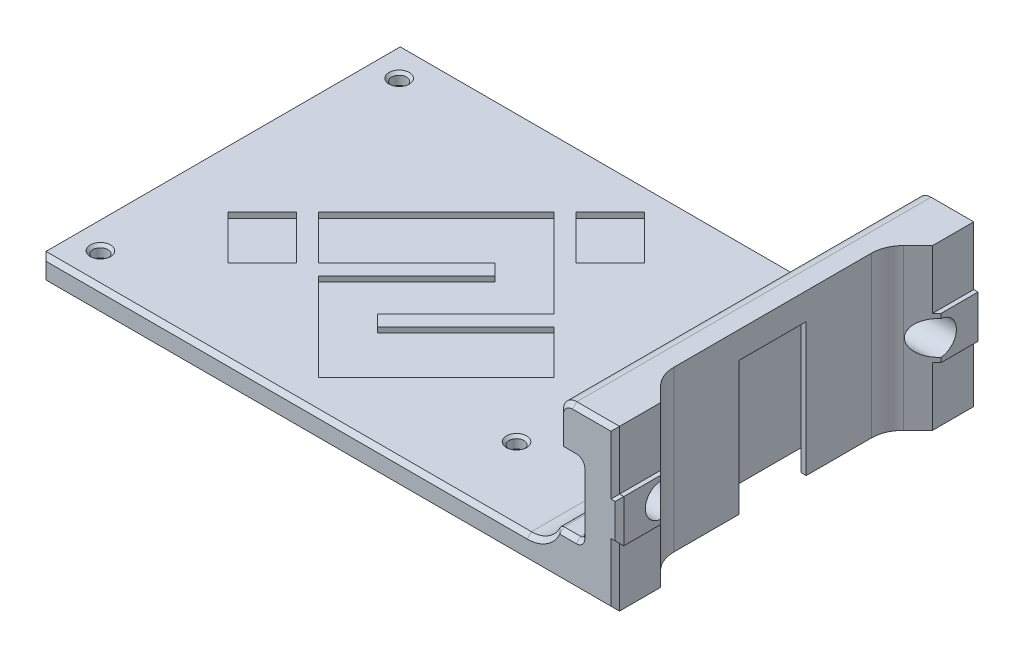
from build123d import *

# Parameters (mm, degrees)
BOSS_MAIN_BODY_DEPTH    = 34
CUT_DOVETAIL_DEPTH      = 25
SKETCH4_R               = 1.4
DRILL_M2_5_HOLES_DEPTH  = 87.327119725
CHAMF_M2_5_SIZE         = 2.5
CHAMF_M2_5_2ND_SIZE     = 0.5
FILLET2_R               = 6
BOSS_EXTRUDE2_DEPTH     = 30
CUT_LOGO_DEPTH          = 1
CUT_LOGO2_START         = -6.431256258
CUT_LOGO2_OUTLINE_W     = 9.1
CUT_LOGO2_OUTLINE_H     = 1
CUT_LOGO2_OUTLINE_W_2   = 31.2
CUT_LOGO2_DEPTH         = 11.7
CUT_LOGO2_START_2       = 19.893743742
CUT_LOGO2_2_OUTLINE_W   = 31.2
CUT_LOGO2_2_OUTLINE_H   = 1
CUT_LOGO2_2_DEPTH       = 11.7
CUT_LOGO2_START_3       = 8.193743742
CUT_LOGO2_3_OUTLINE_W   = 31.2
CUT_LOGO2_3_OUTLINE_H   = 1
CUT_LOGO2_3_DEPTH       = 8.775
CUT_LOGO2_START_4       = 5.268743742
CUT_LOGO2_4_OUTLINE_W   = 7.8
CUT_LOGO2_4_OUTLINE_H   = 1
CUT_LOGO2_4_DEPTH       = 2.925
CUT_LOGO2_START_5       = 16.968743742
CUT_LOGO2_5_OUTLINE_W   = 7.8
CUT_LOGO2_5_OUTLINE_H   = 1
CUT_LOGO2_5_DEPTH       = 2.925
BOSS_DATUM_REACH        = 106.531
SKETCH9_W               = 0.8
SKETCH9_H               = 8
BOSS_EXTRUDE4_START     = -4
BOSS_EXTRUDE4_DEPTH     = 8
FILLET_MAIN_BODY_R      = 2.5
SKETCH8_R               = 3.15
CUT_SCREW_HOLES_DEPTH   = 104.874924789
FILLET3_R               = 6
SKETCH10_W              = 1
SKETCH10_H              = 1
TRIM_DOVETAIL_DEPTH     = 25
HOLE_POCKETS_DEPTH      = 3
HOLE_POCKETS_DEPTH_BACK = 4
FILLET_PEAK_R           = 1.2
FILLET_HOLE_POCKETS_R   = 0.8
CHAMF_FACES_SIZE        = 0.8
CUT_VERSION_NO_DEPTH    = 0.5


# Read off the part's stored shape, not the designer's step: cut_LOGO2, Boss-Extrude4
with BuildPart() as part:
    # Sketch1 → boss_main_body (new, symmetric)
    with BuildSketch(Plane.XY):
        Polygon((-29.54, -10.35), (67.46, -10.35), (67.46, 15), (73.46, 15), (73.46, -15), (-29.54, -15), align=None)
    extrude(amount=BOSS_MAIN_BODY_DEPTH, both=True)

    # Sketch3 → cut_dovetail (cut)
    with BuildSketch(Plane.XZ.offset(15)):
        Polygon((73.46, 5.3), (68.46, 10.3), (68.46, -10.3), (73.46, -5.3), align=None)
    extrude(amount=-CUT_DOVETAIL_DEPTH, mode=Mode.SUBTRACT)

    # Sketch4 → drill_m2.5_holes (cut, through all)
    with BuildSketch(Plane.XZ.offset(15)):
        with Locations(Location((-24.54, 28, 0), (0, 0, 270))):
            Circle(SKETCH4_R)
        with Locations(Location((45.46, 20, 0), (0, 0, 270))):
            Circle(SKETCH4_R)
        with Locations(Location((45.46, -20, 0), (0, 0, 270))):
            Circle(SKETCH4_R)
        with Locations(Location((-24.54, -28, 0), (0, 0, 270))):
            Circle(SKETCH4_R)
    extrude(amount=-DRILL_M2_5_HOLES_DEPTH, mode=Mode.SUBTRACT)

    # chamf_m2.5
    chamf_m2_5_edges = [part.edges().sort_by_distance(p)[0] for p in [
        (-24.54, -15, 29.4),
        (45.46, -15, 21.4),
        (45.46, -15, -18.6),
        (-24.54, -15, -26.6),
    ]]
    chamfer(chamf_m2_5_edges, length=CHAMF_M2_5_SIZE)

    # chamf_m2.5_2nd
    chamf_m2_5_2nd_edges = [part.edges().sort_by_distance(p)[0] for p in [
        (-24.54, -10.35, 29.4),
        (45.46, -10.35, 21.4),
        (45.46, -10.35, -18.6),
        (-24.54, -10.35, -26.6),
    ]]
    chamfer(chamf_m2_5_2nd_edges, length=CHAMF_M2_5_2ND_SIZE)

    # Fillet2
    fillet2_edges = [part.edges().sort_by_distance(p)[0] for p in [
        (67.46, -10.35, 0),
    ]]
    fillet(fillet2_edges, radius=FILLET2_R)

    # Sketch6 → Boss-Extrude2 (add)
    with BuildSketch(Plane(origin=(0, 15, 0), x_dir=(1, 0, 0), z_dir=(0, 1, 0))):
        Polygon((73.46, 34), (77.96, 34), (77.96, 25.5), (73.46, 21), align=None)
        Polygon((73.46, -21), (77.96, -25.5), (77.96, -34), (73.46, -34), align=None)
    extrude(amount=-BOSS_EXTRUDE2_DEPTH)

    # Sketch7 → cut_LOGO (cut)
    with BuildSketch(Plane.XZ.offset(15)):
        Polygon((28.470164677, -21.01903582), (20.197015337, -29.29218516), (13.762343628, -22.857513451), (22.035492968, -14.584364111), align=None)
        Polygon((14.45177274, -7.000643883), (16.520060075, -4.932356548), (-0.026238605, 11.613942132), (16.520060075, 28.160240811), (38.581791648, 6.098509238), (30.308642308, -2.174640102), (13.762343628, 14.371658578), (11.694056293, 12.303371243), (28.240354973, -4.242927437), (11.694056293, -20.789226116), (-10.36767528, 1.272505457), (-2.09452594, 9.545654797), align=None)
        Polygon((-12.435962615, 3.340792792), (-18.870634323, 9.7754645), (-10.597484983, 18.04861384), (-4.162813275, 11.613942131), align=None)
    extrude(amount=-CUT_LOGO_DEPTH, mode=Mode.SUBTRACT)

    # cut_LOGO2 outline → cut_LOGO2 (cut)
    with BuildSketch(Plane(origin=(0, 0, 0), x_dir=(0.707106781186548, 0, -0.707106781186547), z_dir=(0.707106781186547, 0, 0.707106781186548)).offset(CUT_LOGO2_START)):
        with Locations((-15.705850733, -10.85)):
            Rectangle(CUT_LOGO2_OUTLINE_W, CUT_LOGO2_OUTLINE_H)
        with Locations((7.369149267, -10.85)):
            Rectangle(CUT_LOGO2_OUTLINE_W_2, CUT_LOGO2_OUTLINE_H)
        with Locations((30.444149267, -10.85)):
            Rectangle(CUT_LOGO2_OUTLINE_W, CUT_LOGO2_OUTLINE_H)
    extrude(amount=CUT_LOGO2_DEPTH, mode=Mode.SUBTRACT)

    # cut_LOGO2 2 outline → cut_LOGO2 2 (cut)
    with BuildSketch(Plane(origin=(0, 0, 0), x_dir=(0.707106781186548, 0, -0.707106781186547), z_dir=(0.707106781186547, 0, 0.707106781186548)).offset(CUT_LOGO2_START_2)):
        with Locations((7.369149267, -10.85)):
            Rectangle(CUT_LOGO2_2_OUTLINE_W, CUT_LOGO2_2_OUTLINE_H)
    extrude(amount=CUT_LOGO2_2_DEPTH, mode=Mode.SUBTRACT)

    # cut_LOGO2 3 outline → cut_LOGO2 3 (cut)
    with BuildSketch(Plane(origin=(0, 0, 0), x_dir=(0.707106781186548, 0, -0.707106781186547), z_dir=(0.707106781186547, 0, 0.707106781186548)).offset(CUT_LOGO2_START_3)):
        with Locations((7.369149267, -10.85)):
            Rectangle(CUT_LOGO2_3_OUTLINE_W, CUT_LOGO2_3_OUTLINE_H)
    extrude(amount=CUT_LOGO2_3_DEPTH, mode=Mode.SUBTRACT)

    # cut_LOGO2 4 outline → cut_LOGO2 4 (cut)
    with BuildSketch(Plane(origin=(0, 0, 0), x_dir=(0.707106781186548, 0, -0.707106781186547), z_dir=(0.707106781186547, 0, 0.707106781186548)).offset(CUT_LOGO2_START_4)):
        with Locations((19.069149267, -10.85)):
            Rectangle(CUT_LOGO2_4_OUTLINE_W, CUT_LOGO2_4_OUTLINE_H)
    extrude(amount=CUT_LOGO2_4_DEPTH, mode=Mode.SUBTRACT)

    # cut_LOGO2 5 outline → cut_LOGO2 5 (cut)
    with BuildSketch(Plane(origin=(0, 0, 0), x_dir=(0.707106781186548, 0, -0.707106781186547), z_dir=(0.707106781186547, 0, 0.707106781186548)).offset(CUT_LOGO2_START_5)):
        with Locations((-4.330850733, -10.85)):
            Rectangle(CUT_LOGO2_5_OUTLINE_W, CUT_LOGO2_5_OUTLINE_H)
    extrude(amount=CUT_LOGO2_5_DEPTH, mode=Mode.SUBTRACT)

    # boss_datum: up to this plane
    boss_datum_end = Plane(origin=(77.96, -28.756816492, -25.5), z_dir=(0.7071067811865435, 0, 0.7071067811865517))
    # Sketch9 → boss_datum (add, up to the surface)
    with BuildSketch(Plane(origin=(0, 0, -34), x_dir=(-1, 0, 0), z_dir=(0, 0, -1)), mode=Mode.PRIVATE) as boss_datum_sk1:
        with Locations((-78.36, 0)):
            Rectangle(SKETCH9_W, SKETCH9_H)
    boss_datum_tool1 = split(extrude(boss_datum_sk1.sketch, amount=-BOSS_DATUM_REACH, mode=Mode.PRIVATE), bisect_by=boss_datum_end, keep=Keep.BOTH, mode=Mode.PRIVATE)
    add(boss_datum_tool1.solids().sort_by_distance((78.36, 0, -34))[0])

    # Boss-Extrude4 outline → Boss-Extrude4 (add)
    with BuildSketch(Plane(origin=(0, 0, 0), x_dir=(1, 0, 0), z_dir=(0, 1, 0)).offset(BOSS_EXTRUDE4_START)):
        Polygon((78.76, -34), (78.76, -26.3), (77.96, -25.5), (77.96, -34), align=None)
    extrude(amount=BOSS_EXTRUDE4_DEPTH)

    # fillet_main_body
    fillet_main_body_edges = [part.edges().sort_by_distance(p)[0] for p in [
        (67.46, 15, 0),
    ]]
    fillet(fillet_main_body_edges, radius=FILLET_MAIN_BODY_R)

    # Sketch8 → cut_screw_holes (cut, through all)
    with BuildSketch(Plane.ZY.offset(-67.46)):
        with Locations((-26, 0)):
            Circle(SKETCH8_R)
        with Locations((26, 0)):
            Circle(SKETCH8_R)
    extrude(amount=-CUT_SCREW_HOLES_DEPTH, mode=Mode.SUBTRACT)

    # Fillet3
    fillet3_edges = [part.edges().sort_by_distance(p)[0] for p in [
        (73.46, 0, -21),
        (73.46, 0, 21),
    ]]
    fillet(fillet3_edges, radius=FILLET3_R)

    # Sketch10 → trim_dovetail (cut)
    with BuildSketch(Plane.XZ.offset(15)):
        with Locations((72.96, 5.8)):
            Rectangle(SKETCH10_W, SKETCH10_H)
        with Locations((72.96, -5.8)):
            Rectangle(SKETCH10_W, SKETCH10_H)
    extrude(amount=-TRIM_DOVETAIL_DEPTH, mode=Mode.SUBTRACT)

    # Sketch11 → hole_pockets (cut, two sides: drawn at the far end of the back side and taken through both)
    with BuildSketch(Plane.ZY.offset(-67.46).offset(-HOLE_POCKETS_DEPTH_BACK)):
        with BuildLine():
            Line((-26, 6.5), (-34, 6.5))
            Line((-34, 6.5), (-34, -6.5))
            Line((-34, -6.5), (-26, -6.5))
            ThreePointArc((-26, -6.5), (-23.51255769, -6.005216961), (-21.403805922, -4.596194078))
            Line((-21.403805922, -4.596194078), (-16.807611845, 0))
            Line((-16.807611845, 0), (-21.403805922, 4.596194078))
            ThreePointArc((-21.403805922, 4.596194078), (-23.51255769, 6.005216961), (-26, 6.5))
        make_face()
        with BuildLine():
            Line((26, 6.5), (34, 6.5))
            Line((34, 6.5), (34, -6.5))
            Line((34, -6.5), (26, -6.5))
            ThreePointArc((26, -6.5), (23.51255769, -6.005216961), (21.403805922, -4.596194078))
            Line((21.403805922, -4.596194078), (16.807611845, 0))
            Line((16.807611845, 0), (21.403805922, 4.596194078))
            ThreePointArc((21.403805922, 4.596194078), (23.51255769, 6.005216961), (26, 6.5))
        make_face()
    extrude(amount=HOLE_POCKETS_DEPTH + HOLE_POCKETS_DEPTH_BACK, mode=Mode.SUBTRACT)

    # fillet_peak
    fillet_peak_edges = [part.edges().sort_by_distance(p)[0] for p in [
        (69.46, 0, 16.807611845),
        (69.46, 0, -16.807611845),
    ]]
    fillet(fillet_peak_edges, radius=FILLET_PEAK_R)

    # fillet_hole_pockets
    fillet_hole_pockets_edges = [part.edges().sort_by_distance(p)[0] for p in [
        (67.458736861, -4.473110005, -21.28072185),
        (67.227398165, -6.004423918, -23.510643977),
        (67.061562282, -6.5, -30),
        (67.061562282, -6.5, 30),
        (67.227398165, -6.004423918, 23.510643977),
        (67.458736861, -4.473110005, 21.28072185),
        (67.46, 6.005216961, -23.51255769),
        (67.46, 6.005216961, 23.51255769),
        (67.46, 2.722361108, 19.529972952),
        (71.46, 6.005216961, 23.51255769),
        (71.46, 2.722361108, 19.529972952),
        (71.46, 6.5, 30),
        (71.46, -6.005216961, 23.51255769),
        (71.46, -6.5, 30),
        (67.46, 6.5, 30),
        (71.46, 6.005216961, -23.51255769),
        (71.46, 6.5, -30),
        (71.46, -6.5, -30),
        (71.46, -6.005216961, -23.51255769),
        (71.46, -2.722361108, -19.529972952),
        (67.46, 6.5, -30),
        (67.46, -2.599264069, -19.406875913),
        (71.46, -2.722361108, 19.529972952),
        (71.46, 0, 17.304668119),
        (67.46, -2.599264069, 19.406875913),
        (71.46, 2.722361108, -19.529972952),
        (71.46, 0, -17.304668119),
        (67.46, 2.722361108, -19.529972952),
        (67.46, 0, 17.304668119),
        (67.46, 0, -17.304668119),
    ]]
    fillet(fillet_hole_pockets_edges, radius=FILLET_HOLE_POCKETS_R)

    # chamf_faces
    chamf_faces_edges = [part.edges().sort_by_distance(p)[0] for p in [
        (24.21, -15, -34),
        (77.96, 9.5, -34),
        (77.96, -9.5, -34),
        (73.96, 15, -34),
        (67.46, 9.9, 34),
        (67.46, 9.9, -34),
        (64.652362209, -9.430238531, -34),
        (64.652362209, -9.430238531, 34),
        (15.96, -10.35, 34),
        (15.96, -10.35, -34),
        (-29.54, -12.675, -34),
        (-29.54, -12.675, 34),
        (73.96, 15, 34),
        (77.96, -9.5, 34),
        (77.96, 9.5, 34),
        (24.21, -15, 34),
        (68.192233047, 14.267766953, 34),
        (68.192233047, 14.267766953, -34),
        (78.36, -4, -34),
        (78.76, 0, -34),
        (78.36, 4, -34),
        (78.36, 4, 34),
        (78.76, 0, 34),
        (78.36, -4, 34),
        (71.46, 0, -34),
        (69.123392727, -6.5, -34),
        (69.46, 6.5, -34),
        (69.46, 6.5, 34),
        (69.123392727, -6.5, 34),
        (71.46, 0, 34),
        (71.225685425, 6.265685425, -34),
        (71.225685425, -6.265685425, -34),
        (67.16113716, -6.622634863, -34),
        (67.694314575, 6.734314575, -34),
        (67.16113716, -6.622634863, 34),
        (71.225685425, -6.265685425, 34),
        (71.225685425, 6.265685425, 34),
        (67.694314575, 6.734314575, 34),
    ]]
    chamfer(chamf_faces_edges, length=CHAMF_FACES_SIZE - 0.0001)  # a hair under: the kernel refuses the full size

    # Sketch12 → cut_version_No (cut)
    # profile 1 of 4: a face of its own
    with BuildSketch(Plane.XZ.offset(15)):
        with BuildLine():
            add(Edge.make_bspline(
                [(-16.941512481, -24.084865663), (-16.939266039, -24.104295768), (-16.934915441, -24.141925322), (-16.922725099, -24.177780618), (-16.916829268, -24.195121951)],
                knots=[0, 0, 0, 0, 1.032704525, 2, 2, 2, 2], degree=3))
            Line((-16.916829268, -24.195121951), (-15.719249238, -27.77648509))
            add(Edge.make_bspline(
                [(-15.719249238, -27.77648509), (-15.706158729, -27.80789855), (-15.681241866, -27.867691862), (-15.613281502, -27.936414851), (-15.529557542, -27.983520924), (-15.465842153, -27.991953119), (-15.432682927, -27.996341463)],
                knots=[0, 0, 0, 0, 1.054683453, 2.007515722, 2.96305683, 4, 4, 4, 4], degree=3))
            add(Edge.make_bspline(
                [(-15.432682927, -27.996341463), (-15.397919516, -27.992026061), (-15.331876221, -27.983827687), (-15.245120587, -27.937212007), (-15.176949217, -27.867675055), (-15.151914442, -27.808089528), (-15.138780488, -27.776829268)],
                knots=[0, 0, 0, 0, 1.06836729, 2.029677035, 2.966312611, 4, 4, 4, 4], degree=3))
            Line((-15.138780488, -27.776829268), (-13.940645484, -24.194184689))
            add(Edge.make_bspline(
                [(-13.940645484, -24.194184689), (-13.936201969, -24.177105546), (-13.926917044, -24.141417907), (-13.925095923, -24.104576142), (-13.924146341, -24.085365854)],
                knots=[0, 0, 0, 0, 0.957146177, 2, 2, 2, 2], degree=3))
            add(Edge.make_bspline(
                [(-13.924146341, -24.085365854), (-13.925769724, -24.065295583), (-13.928911508, -24.026452945), (-13.947211905, -23.971225807), (-13.97362859, -23.920299891), (-14.012145008, -23.876818457), (-14.057421034, -23.84010539), (-14.108529001, -23.811121378), (-14.166812568, -23.79556053), (-14.206994554, -23.792057914), (-14.227804878, -23.790243902)],
                knots=[0, 0, 0, 0, 1.027789528, 1.989114056, 2.957849911, 3.946954469, 4.938684973, 5.935646619, 6.930867606, 8, 8, 8, 8], degree=3))
            add(Edge.make_bspline(
                [(-14.227804878, -23.790243902), (-14.26088275, -23.794763663), (-14.324249761, -23.803422132), (-14.409193742, -23.848700331), (-14.475838962, -23.918897605), (-14.50116445, -23.978585262), (-14.514390244, -24.009756098)],
                knots=[0, 0, 0, 0, 1.03692919, 1.986436811, 2.948451835, 4, 4, 4, 4], degree=3))
            Line((-14.514390244, -24.009756098), (-15.432649581, -26.742158918))
            Line((-15.432649581, -26.742158918), (-16.343024962, -24.00918326))
            add(Edge.make_bspline(
                [(-16.343024962, -24.00918326), (-16.356476638, -23.978195042), (-16.382374756, -23.918534329), (-16.450385958, -23.848247255), (-16.538345611, -23.803073446), (-16.604080541, -23.794676471), (-16.638780488, -23.790243902)],
                knots=[0, 0, 0, 0, 1.028913269, 1.980936724, 2.934183284, 4, 4, 4, 4], degree=3))
            add(Edge.make_bspline(
                [(-16.638780488, -23.790243902), (-16.658779752, -23.792076376), (-16.697755011, -23.795647563), (-16.754754829, -23.811347063), (-16.805650967, -23.840424361), (-16.851991888, -23.876727956), (-16.891567827, -23.920256963), (-16.919587287, -23.970899614), (-16.937599876, -24.02649028), (-16.940790438, -24.065308303), (-16.942439024, -24.085365854)],
                knots=[0, 0, 0, 0, 1.030543514, 2.008358934, 3.007991962, 4.018680577, 5.024181706, 6.005556065, 6.969456486, 8, 8, 8, 8], degree=3))
            Line((-16.942439024, -24.085365854), (-16.941512481, -24.084865663))
        make_face()
    # profile 2 of 4: a face of its own
    with BuildSketch(Plane.XZ.offset(15)):
        with BuildLine():
            add(Edge.make_bspline(
                [(-12.400008575, -23.271105659), (-12.414009335, -23.28506054), (-12.441732789, -23.312693149), (-12.471510715, -23.363961301), (-12.48866863, -23.42171657), (-12.491959181, -23.462081143), (-12.493658537, -23.482926829)],
                knots=[0, 0, 0, 0, 0.992164211, 1.96462331, 2.948859839, 4, 4, 4, 4], degree=3))
            add(Edge.make_bspline(
                [(-12.493658537, -23.482926829), (-12.49201893, -23.503798604), (-12.488844076, -23.544213692), (-12.470875542, -23.601572927), (-12.444226845, -23.654075328), (-12.405615901, -23.69853764), (-12.361149291, -23.737174646), (-12.308638069, -23.763724638), (-12.251361498, -23.782060995), (-12.210883259, -23.784241106), (-12.19, -23.785365854)],
                knots=[0, 0, 0, 0, 1.0530203, 2.0390173, 3.01127151, 4.001099292, 4.990927074, 5.963181283, 6.949178283, 8, 8, 8, 8], degree=3))
            add(Edge.make_bspline(
                [(-12.19, -23.785365854), (-12.168315492, -23.783291855), (-12.126232736, -23.779266881), (-12.067035277, -23.760643409), (-12.014027983, -23.732358719), (-11.985039866, -23.705943427), (-11.970487805, -23.692682927)],
                knots=[0, 0, 0, 0, 1.06971459, 2.075976935, 3.034138695, 4, 4, 4, 4], degree=3))
            Line((-11.970487805, -23.692682927), (-11.274429783, -22.980331793))
            Line((-11.274429783, -22.980331793), (-11.274429783, -27.692393531))
            add(Edge.make_bspline(
                [(-11.274429783, -27.692393531), (-11.273187591, -27.71336664), (-11.270785705, -27.753919969), (-11.25259112, -27.811381007), (-11.22581509, -27.863383958), (-11.188641777, -27.90873739), (-11.144197713, -27.946472319), (-11.09289225, -27.973612607), (-11.036661538, -27.991514089), (-10.997048422, -27.99469717), (-10.976585366, -27.996341463)],
                knots=[0, 0, 0, 0, 1.064897874, 2.059072668, 3.039390689, 4.024276954, 5.022314302, 5.984364611, 6.958777708, 8, 8, 8, 8], degree=3))
            add(Edge.make_bspline(
                [(-10.976585366, -27.996341463), (-10.956137958, -27.994646092), (-10.916167057, -27.991331954), (-10.859366625, -27.973896688), (-10.807795113, -27.946429806), (-10.763176801, -27.908805727), (-10.726494741, -27.863007391), (-10.697450098, -27.811974605), (-10.681905454, -27.753670945), (-10.678400558, -27.713491787), (-10.676585366, -27.692682927)],
                knots=[0, 0, 0, 0, 1.038553346, 2.030179789, 2.989764092, 3.985243189, 4.967604913, 5.955148361, 6.940967594, 8, 8, 8, 8], degree=3))
            Line((-10.676585366, -27.692682927), (-10.676585366, -22.295663824))
            add(Edge.make_bspline(
                [(-10.676585366, -22.295663824), (-10.67844907, -22.275494804), (-10.682101441, -22.235968827), (-10.697426194, -22.178249017), (-10.726558361, -22.127309635), (-10.762785276, -22.081370145), (-10.808224488, -22.045133638), (-10.859320003, -22.017578591), (-10.916104751, -21.999852514), (-10.956131253, -21.997528876), (-10.976585366, -21.996341463)],
                knots=[0, 0, 0, 0, 1.033276339, 2.024949948, 3.018358012, 4.006553579, 4.994749146, 5.960032027, 6.957547333, 8, 8, 8, 8], degree=3))
            add(Edge.make_bspline(
                [(-10.976585366, -21.996341463), (-10.997034771, -21.997528773), (-11.036663101, -21.999829626), (-11.093205499, -22.017316399), (-11.142945911, -22.0472034), (-11.17017539, -22.074196828), (-11.183902439, -22.087804878)],
                knots=[0, 0, 0, 0, 1.049879887, 2.034532876, 3.009159723, 4, 4, 4, 4], degree=3))
            Line((-11.183902439, -22.087804878), (-12.400008575, -23.271105659))
        make_face()
    # profile 3 of 4: a face of its own
    with BuildSketch(Plane.XZ.offset(15)):
        with BuildLine():
            add(Edge.make_bspline(
                [(-9.258092607, -27.68091654), (-9.257018447, -27.702048593), (-9.254928801, -27.743158401), (-9.236977491, -27.801300767), (-9.20969125, -27.854135228), (-9.171969435, -27.899827462), (-9.126600291, -27.938088333), (-9.074554839, -27.966735829), (-9.016290485, -27.984234789), (-8.97548515, -27.986597542), (-8.954634146, -27.987804878)],
                knots=[0, 0, 0, 0, 1.053795159, 2.050028647, 3.013195991, 4.009429478, 4.990006149, 5.962765968, 6.958999455, 8, 8, 8, 8], degree=3))
            add(Edge.make_bspline(
                [(-8.954634146, -27.987804878), (-8.933768856, -27.986648054), (-8.893325446, -27.984405771), (-8.835616016, -27.966454085), (-8.783880666, -27.938113353), (-8.738519334, -27.89982068), (-8.700799729, -27.85413672), (-8.673497044, -27.801301329), (-8.655688196, -27.743401277), (-8.653376413, -27.702571044), (-8.652195122, -27.681707317)],
                knots=[0, 0, 0, 0, 1.045213593, 2.025948432, 3.002645121, 3.987190297, 4.987455656, 5.954521048, 6.954786407, 8, 8, 8, 8], degree=3))
            Line((-8.652195122, -27.681707317), (-8.651175686, -27.382552877))
            add(Edge.make_bspline(
                [(-8.651175686, -27.382552877), (-8.652754604, -27.361002338), (-8.65582263, -27.319127062), (-8.673530097, -27.259788488), (-8.700116392, -27.205963677), (-8.738648185, -27.161154462), (-8.783914505, -27.123925955), (-8.835942841, -27.097185562), (-8.893287066, -27.07893233), (-8.933755794, -27.076740533), (-8.954634146, -27.075609756)],
                knots=[0, 0, 0, 0, 1.076562654, 2.091889952, 3.072719245, 4.052917712, 5.020200157, 5.982996012, 6.959400964, 8, 8, 8, 8], degree=3))
            add(Edge.make_bspline(
                [(-8.954634146, -27.075609756), (-8.975498234, -27.076791066), (-9.016329173, -27.079102884), (-9.074224162, -27.096911477), (-9.126567168, -27.123951104), (-9.171837113, -27.161148034), (-9.210387931, -27.205963802), (-9.236893241, -27.259794523), (-9.254948324, -27.319187294), (-9.257154846, -27.361241006), (-9.258292683, -27.382926829)],
                knots=[0, 0, 0, 0, 1.037498569, 2.03038068, 2.990307883, 3.954708309, 4.931986273, 5.909893183, 6.922195311, 8, 8, 8, 8], degree=3))
            Line((-9.258292683, -27.382926829), (-9.258092607, -27.68091654))
        make_face()
    # profile 4 of 4: a face of its own
    with BuildSketch(Plane.XZ.offset(15)):
        with BuildLine():
            add(Edge.make_bspline(
                [(-7.228824314, -24.996751143), (-7.226184395, -25.100318529), (-7.221008974, -25.30335695), (-7.197266518, -25.601056406), (-7.162800616, -25.885725514), (-7.113651015, -26.156731211), (-7.053419548, -26.414793233), (-6.978504184, -26.659354013), (-6.892303757, -26.891323319), (-6.794525918, -27.108332319), (-6.687265975, -27.305899448), (-6.572943982, -27.480346859), (-6.452135606, -27.628941442), (-6.32563872, -27.753139331), (-6.192720997, -27.852039234), (-6.052154256, -27.923985332), (-5.905979421, -27.972483048), (-5.804981104, -27.982707874), (-5.754634146, -27.987804878)],
                knots=[0, 0, 0, 0, 1.380940002, 2.707260338, 3.979707887, 5.202173116, 6.377319108, 7.510478327, 8.60969502, 9.674452737, 10.680903401, 11.603782673, 12.451037913, 13.229028518, 13.961761714, 14.650102432, 15.327085458, 16, 16, 16, 16], degree=3))
            add(Edge.make_bspline(
                [(-5.754634146, -27.987804878), (-5.703865586, -27.982760694), (-5.602425787, -27.972681995), (-5.455657658, -27.923661664), (-5.314264361, -27.85248361), (-5.181172327, -27.752707536), (-5.053489526, -27.629377218), (-4.932595244, -27.480631913), (-4.819758769, -27.305508431), (-4.712277271, -27.108364374), (-4.61433728, -26.89154518), (-4.529518032, -26.659308437), (-4.45623936, -26.414572486), (-4.395129869, -26.156899123), (-4.348159628, -25.885567117), (-4.313071967, -25.601081722), (-4.289590962, -25.303615181), (-4.284206489, -25.100855292), (-4.281463415, -24.997560976)],
                knots=[0, 0, 0, 0, 0.678150062, 1.355000155, 2.048030508, 2.780619824, 3.562354264, 4.409443136, 5.329161474, 6.335414509, 7.399963149, 8.497079114, 9.62844701, 10.803362249, 12.024638282, 13.296835971, 14.62289587, 16, 16, 16, 16], degree=3))
            add(Edge.make_bspline(
                [(-4.281463415, -24.997560976), (-4.284203425, -24.893454206), (-4.289571961, -24.689476548), (-4.312979252, -24.390778717), (-4.348283243, -24.105511304), (-4.395099233, -23.833343489), (-4.456324044, -23.574490592), (-4.529025657, -23.329142583), (-4.614644212, -23.097182247), (-4.712260794, -22.880664317), (-4.81969186, -22.683457391), (-4.933013582, -22.508329265), (-5.05307321, -22.358493193), (-5.181217856, -22.235134363), (-5.314253205, -22.135312197), (-5.455660487, -22.064145514), (-5.602425085, -22.015122313), (-5.703865352, -22.005043994), (-5.754634146, -22)],
                knots=[0, 0, 0, 0, 1.385237019, 2.714111726, 3.983837397, 5.208066892, 6.385961822, 7.520312088, 8.610223523, 9.672703629, 10.677001406, 11.594932631, 12.444567778, 13.224783223, 13.955949038, 14.647632758, 15.323167657, 16, 16, 16, 16], degree=3))
            add(Edge.make_bspline(
                [(-5.754634146, -22), (-5.804981336, -22.005096816), (-5.905980118, -22.015321263), (-6.052151428, -22.063821847), (-6.19273209, -22.135756616), (-6.325593179, -22.234702611), (-6.452549561, -22.358931251), (-6.57252326, -22.508615994), (-6.687332652, -22.683066508), (-6.794542991, -22.880695929), (-6.891995123, -23.097406304), (-6.979003791, -23.329091969), (-7.053334548, -23.574271508), (-7.113682147, -23.833510507), (-7.16267132, -24.105354185), (-7.197373334, -24.390803384), (-7.220951994, -24.689469954), (-7.226296595, -24.893451978), (-7.228824314, -24.996751143)],
                knots=[0, 0, 0, 0, 0.671756247, 1.347573975, 2.034729845, 2.76620178, 3.542853222, 4.392844089, 5.3141348, 6.318853049, 7.381777987, 8.474036494, 9.61042096, 10.788809044, 12.014494676, 13.284751947, 14.614183019, 16, 16, 16, 16], degree=3))
        make_face()
        with BuildLine():
            add(Edge.make_bspline(
                [(-6.621907393, -24.996751143), (-6.620860054, -24.913667417), (-6.618806729, -24.750780547), (-6.604862185, -24.511905498), (-6.584513461, -24.283680555), (-6.556469703, -24.066440249), (-6.521638846, -23.859540605), (-6.477463754, -23.664017876), (-6.427822304, -23.479031055), (-6.371281893, -23.307020027), (-6.308491899, -23.150608002), (-6.241804961, -23.012115146), (-6.171605498, -22.8931721), (-6.0974496, -22.793794853), (-6.017905607, -22.716017126), (-5.934619419, -22.657883937), (-5.846604415, -22.619277704), (-5.785053245, -22.610456884), (-5.754634146, -22.606097561)],
                knots=[0, 0, 0, 0, 1.477662678, 2.896979474, 4.254571341, 5.552216578, 6.791951478, 7.984731942, 9.115995605, 10.197435787, 11.203034613, 12.111663328, 12.928785221, 13.656149725, 14.310617655, 14.89821091, 15.455486688, 16, 16, 16, 16], degree=3))
            add(Edge.make_bspline(
                [(-5.754634146, -22.606097561), (-5.72378594, -22.610394055), (-5.661773181, -22.619031103), (-5.573274375, -22.658248046), (-5.488958662, -22.715515951), (-5.409506624, -22.794235898), (-5.333785833, -22.89268876), (-5.263984258, -23.012228779), (-5.196816473, -23.150310565), (-5.135880216, -23.307327872), (-5.079084397, -23.479024041), (-5.028639019, -23.663690492), (-4.988490051, -23.859901101), (-4.952516073, -24.066384436), (-4.924947321, -24.283702057), (-4.90390773, -24.511855718), (-4.892366205, -24.751109804), (-4.88918598, -24.914217567), (-4.887560976, -24.997560976)],
                knots=[0, 0, 0, 0, 0.551058168, 1.107767397, 1.70073176, 2.354534332, 3.085561352, 3.901852526, 4.809557492, 5.811456046, 6.891796792, 8.021910366, 9.210409631, 10.448884166, 11.745210164, 13.101421848, 14.518909335, 16, 16, 16, 16], degree=3))
            add(Edge.make_bspline(
                [(-4.887560976, -24.997560976), (-4.889186836, -25.08049783), (-4.892368402, -25.242792904), (-4.903894821, -25.480830224), (-4.925020976, -25.708161678), (-4.952534426, -25.925074582), (-4.988333464, -26.131188098), (-5.028787807, -26.326932381), (-5.079286602, -26.511556096), (-5.135838223, -26.6841456), (-5.196955912, -26.842275856), (-5.263308398, -26.981228801), (-5.334130815, -27.100211822), (-5.409825846, -27.198530619), (-5.4889438, -27.27825186), (-5.572938675, -27.336908549), (-5.661681325, -27.376333041), (-5.723779525, -27.383996933), (-5.754634146, -27.387804878)],
                knots=[0, 0, 0, 0, 1.474511475, 2.885399372, 4.2350052, 5.531895279, 6.770908721, 7.952856191, 9.08346152, 10.17113457, 11.180192321, 12.094794837, 12.905247964, 13.636593082, 14.295729553, 14.893030622, 15.449982096, 16, 16, 16, 16], degree=3))
            add(Edge.make_bspline(
                [(-5.754634146, -27.387804878), (-5.785059808, -27.38393381), (-5.846698637, -27.376091479), (-5.934959866, -27.33727112), (-6.017911289, -27.277747881), (-6.097134911, -27.198974529), (-6.17126482, -27.099731874), (-6.242480392, -26.981342154), (-6.308349959, -26.841979338), (-6.371324745, -26.684451516), (-6.42762354, -26.511550595), (-6.47731118, -26.326601786), (-6.521798809, -26.131551854), (-6.556453276, -25.925018057), (-6.584424195, -25.708183003), (-6.604940405, -25.480781666), (-6.618561166, -25.24283947), (-6.621450504, -25.080506188), (-6.622926829, -24.997560976)],
                knots=[0, 0, 0, 0, 0.543283811, 1.100629399, 1.692419046, 2.352021939, 3.079477559, 3.890504184, 4.805753897, 5.818188868, 6.906631584, 8.03803696, 9.223911211, 10.463801412, 11.761609204, 13.11217005, 14.524445121, 16, 16, 16, 16], degree=3))
            Line((-6.622926829, -24.997560976), (-6.621907393, -24.996751143))
        make_face(mode=Mode.SUBTRACT)
    extrude(amount=-CUT_VERSION_NO_DEPTH, mode=Mode.SUBTRACT)


solid = part.part
